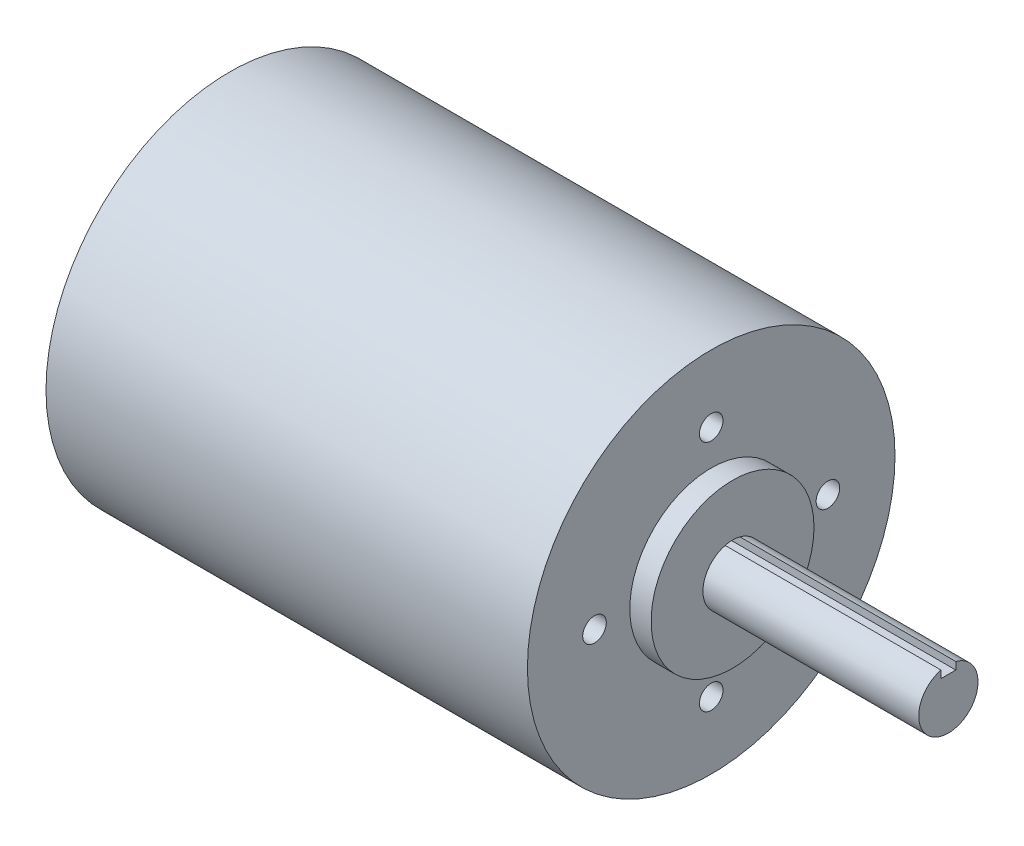
from build123d import *

# Parameters (mm, degrees)
SKETCH1_R                 = 39.37
BOSS_EXTRUDE1_DEPTH       = 103.124
BOSS_EXTRUDE2_DEPTH       = 50.8
CIRPATTERN1_COUNT         = 4
SKETCH6_R                 = 17.4498
SKETCH6_R_2               = 6.35
BOSS_EXTRUDE3_DEPTH       = 4.572
SKETCH7_R                 = 4.7625
BOSS_EXTRUDE4_DEPTH       = 12.7
F_4_40_TAPPED_HOLE1_D     = 2.2606
F_4_40_TAPPED_HOLE1_DEPTH = 7.59
F_4_40_TAPPED_HOLE1_TIP   = 0.679152758
F_6_32_TAPPED_HOLE1_D     = 2.7051
F_6_32_TAPPED_HOLE1_DEPTH = 9.39
F_6_32_TAPPED_HOLE1_TIP   = 0.81269403


with BuildPart() as part:
    # Sketch1 → Boss-Extrude1 (new body)
    with BuildSketch(Plane(origin=(0, 0, 0), x_dir=(0, 0, -1), z_dir=(1, 0, 0))):
        Circle(SKETCH1_R)
    extrude(amount=BOSS_EXTRUDE1_DEPTH)

    # Sketch2 → Boss-Extrude2 (add)
    with BuildSketch(Plane(origin=(103.124, 0, 0), x_dir=(0, 0, -1), z_dir=(1, 0, 0))):
        with BuildLine():
            Line((-1.5875, 6.148361062), (-1.5875, 4.560861062))
            Line((-1.5875, 4.560861062), (1.5875, 4.560861062))
            Line((1.5875, 4.560861062), (1.5875, 6.148361062))
            ThreePointArc((1.5875, 6.148361062), (0, -6.35), (-1.5875, 6.148361062))
        make_face()
    extrude(amount=BOSS_EXTRUDE2_DEPTH)

    # Sketch4 → #8 (0.199) Diameter Hole1 (revolve, cut)
    with BuildSketch(Plane(origin=(103.124, 25, 0), x_dir=(0, 0, -1), z_dir=(0, 1, 0))):
        Polygon((0, 0), (0, 11.518555042), (2.5273, 10), (2.5273, 0), align=None)
    f_8_0_199_diameter_hole1 = revolve(axis=Axis((109.474, 25, 0), (-1, 0, 0)), mode=Mode.SUBTRACT)

    # CirPattern1: #8 (0.199) Diameter Hole1 ×4 about axis
    cirpattern1_axis = Axis((153.924, 0, 0), (-1, 0, 0))
    for i in range(1, CIRPATTERN1_COUNT):
        add(f_8_0_199_diameter_hole1.rotate(cirpattern1_axis, i * 360 / CIRPATTERN1_COUNT), mode=Mode.SUBTRACT)

    # Sketch6 → Boss-Extrude3 (add)
    with BuildSketch(Plane(origin=(103.124, 0, 0), x_dir=(0, 0, -1), z_dir=(1, 0, 0))):
        Circle(SKETCH6_R)
        Circle(SKETCH6_R_2, mode=Mode.SUBTRACT)
    extrude(amount=BOSS_EXTRUDE3_DEPTH)

    # Sketch7 → Boss-Extrude4 (add)
    with BuildSketch(Plane.ZY):
        Circle(SKETCH7_R)
    extrude(amount=BOSS_EXTRUDE4_DEPTH)

    # #4-40 Tapped Hole1
    with Locations(Plane.ZY):
        with Locations((-23, 0), (23, 0)):
            Hole(F_4_40_TAPPED_HOLE1_D / 2, depth=F_4_40_TAPPED_HOLE1_DEPTH)
            with Locations((0, 0, -(F_4_40_TAPPED_HOLE1_DEPTH + F_4_40_TAPPED_HOLE1_TIP / 2))):  # 118° drill point
                Cone(0, F_4_40_TAPPED_HOLE1_D / 2, F_4_40_TAPPED_HOLE1_TIP, mode=Mode.SUBTRACT)

    # #6-32 Tapped Hole1
    with Locations(Plane.ZY):
        with Locations((28.296788218, 19.813624417), (-28.296788218, -19.813624417), (19.813624417, -28.296788218), (-19.813624417, 28.296788218)):
            Hole(F_6_32_TAPPED_HOLE1_D / 2, depth=F_6_32_TAPPED_HOLE1_DEPTH)
            with Locations((0, 0, -(F_6_32_TAPPED_HOLE1_DEPTH + F_6_32_TAPPED_HOLE1_TIP / 2))):  # 118° drill point
                Cone(0, F_6_32_TAPPED_HOLE1_D / 2, F_6_32_TAPPED_HOLE1_TIP, mode=Mode.SUBTRACT)


solid = part.part
